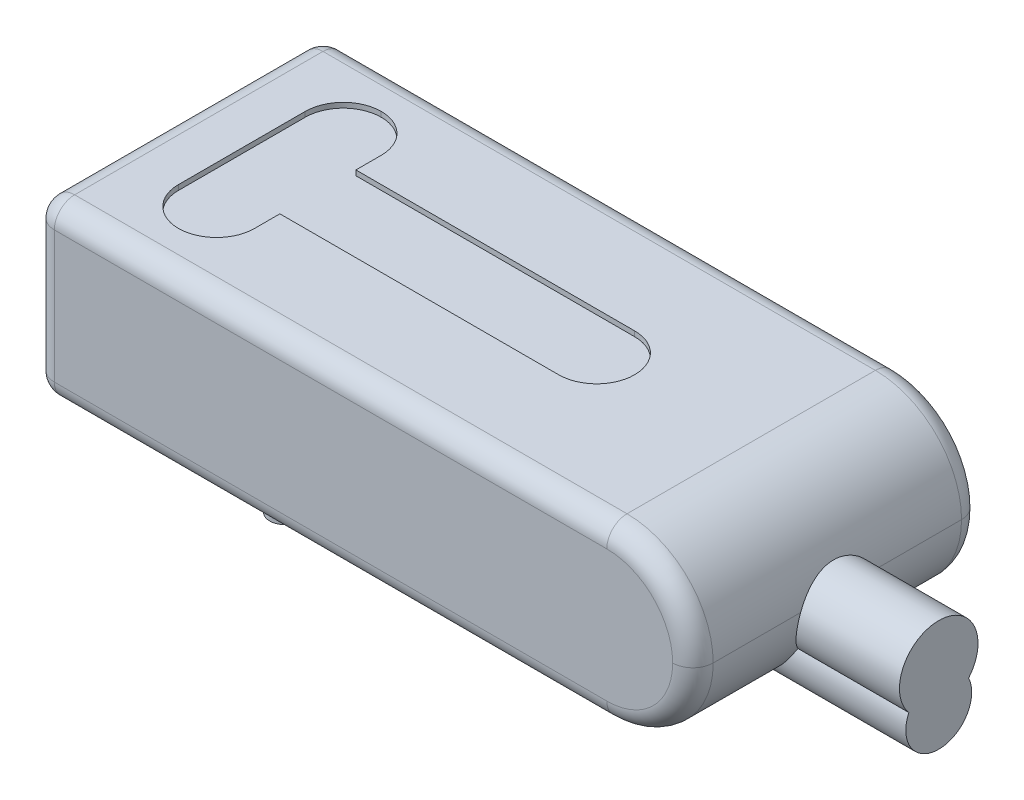
from build123d import *
from build123d.topology import SkipClean

# Parameters (mm, degrees)
CROQUIS1_W              = 130
CROQUIS1_H              = 57
SALIENTE_EXTRUIR1_DEPTH = 34
REDONDEO1_R             = 17
CROQUIS2_R              = 6.5
CROQUIS2_R_2            = 7.75
SALIENTE_EXTRUIR2_DEPTH = 37
REDONDEO2_R             = 4
CROQUIS3_W              = 62.5
CROQUIS3_H              = 15
CROQUIS3_W_2            = 7.5
CORTAR_EXTRUIR1_DEPTH   = 1
REDONDEO3_R             = 7.5
CROQUIS4_R              = 1.6
CORTAR_EXTRUIR3_DEPTH   = 10
SALIENTE_EXTRUIR3_START = 2
CROQUIS5_R              = 3
CROQUIS5_R_2            = 1.6
SALIENTE_EXTRUIR3_DEPTH = 2
ROSCA1_PITCH            = 0.5
CROQUIS6_W              = 50
CROQUIS6_H              = 0.5
CORTAR_EXTRUIR4_DEPTH   = 10


with BuildPart() as part:
    # Croquis1 → Saliente-Extruir1 (new body)
    with BuildSketch(Plane(origin=(0, 0, 0), x_dir=(1, 0, 0), z_dir=(0, 1, 0))):
        Rectangle(CROQUIS1_W, CROQUIS1_H)
    extrude(amount=SALIENTE_EXTRUIR1_DEPTH)

    # Redondeo1
    redondeo1_edges = [part.edges().sort_by_distance(p)[0] for p in [
        (65, 0, 0),
        (65, 34, 0),
    ]]
    fillet(redondeo1_edges, radius=REDONDEO1_R - 0.0001)  # a hair under: the kernel refuses the full size

    # Croquis2 → Saliente-Extruir2 (add)
    with BuildSketch(Plane(origin=(48, 0, 0), x_dir=(0, 0, -1), z_dir=(1, 0, 0))):
        with Locations((0, 6.5)):
            Circle(CROQUIS2_R)
        with Locations((0, 14.25)):
            Circle(CROQUIS2_R_2)
    extrude(amount=SALIENTE_EXTRUIR2_DEPTH)

    # Redondeo2
    redondeo2_edges = [part.edges().sort_by_distance(p)[0] for p in [
        (-65, 34, 0),
        (-8.49995, 34, 28.5),
        (-8.49995, 0, -28.5),
        (-8.49995, 34, -28.5),
        (60.020844569, 29.020844569, -28.5),
        (60.020844569, 4.979155431, -28.5),
        (60.020844569, 29.020844569, 28.5),
        (60.020844569, 4.979155431, 28.5),
        (-8.49995, 0, 28.5),
        (-65, 0, 0),
        (-65, 17, 28.5),
        (-65, 17, -28.5),
    ]]
    fillet(redondeo2_edges, radius=REDONDEO2_R)

    # Croquis3 → Cortar-Extruir1 (cut)
    with BuildSketch(Plane(origin=(0, 34, 0), x_dir=(1, 0, 0), z_dir=(0, 1, 0))):
        with Locations((-6.25, 0)):
            Rectangle(CROQUIS3_W, CROQUIS3_H)
        with Locations((-41.25, 0)):
            Rectangle(CROQUIS3_W_2, CROQUIS3_H)
        Polygon((-45, 7.5), (-37.5, 7.5), (-37.5, 20), (-52.5, 20), (-52.5, -20), (-37.5, -20), (-37.5, -7.5), (-45, -7.5), align=None)
    extrude(amount=-CORTAR_EXTRUIR1_DEPTH, mode=Mode.SUBTRACT)

    # Redondeo3
    redondeo3_edges = [part.edges().sort_by_distance(p)[0] for p in [
        (-52.5, 33.5, -20),
        (-37.5, 33.5, -20),
        (25, 33.5, -7.5),
        (25, 33.5, 7.5),
        (-52.5, 33.5, 20),
        (-37.5, 33.5, 20),
    ]]
    fillet(redondeo3_edges, radius=REDONDEO3_R - 0.0001)  # a hair under: the kernel refuses the full size

    # Croquis4 → Cortar-Extruir3 (cut)
    with BuildSketch(Plane.XZ):
        with Locations(Location((-20, -24, 0), (0, 0, 270))):
            Circle(CROQUIS4_R)
    cortar_extruir3 = extrude(amount=-CORTAR_EXTRUIR3_DEPTH, mode=Mode.SUBTRACT)

    # Croquis5 → Saliente-Extruir3 (add)
    with SkipClean():  # the faces are left unmerged after this step: merging them gives an invalid solid
        with BuildSketch(Plane(origin=(0, 2, 0), x_dir=(-1, 0, 0), z_dir=(0, -1, 0)).offset(SALIENTE_EXTRUIR3_START)):
            with Locations((20, 24)):
                Circle(CROQUIS5_R)
            with Locations(Location((20, 24, 0), (0, 0, 90))):
                Circle(CROQUIS5_R_2, mode=Mode.SUBTRACT)
        saliente_extruir3 = extrude(amount=-SALIENTE_EXTRUIR3_DEPTH)

    # Rosca1: the profile of Perfil de rosca1 profile screwed along a right-hand helix of 20 turns, 6 arcs to a turn; built about Z, then put on its axis
    rosca1_z = Axis((0, 0, 0), (0, 0, 1))
    rosca1_corners = [(1.5997, 0, -0.000173205), (1.870632938, 0, 0.156249999), (1.870632938, 0, 0.218749999), (1.5997, 0, 0.375173204)]
    with BuildLine(mode=Mode.PRIVATE) as rosca1_profile:
        Line(rosca1_corners[0], rosca1_corners[1])
        Line(rosca1_corners[1], rosca1_corners[2])
        Line(rosca1_corners[2], rosca1_corners[3])
        Line(rosca1_corners[3], rosca1_corners[0])
    rosca1_cap = Face(rosca1_profile.wire())
    rosca1_turn_angles = [0, 30, 60, 90, 120, 150, 180, 210, 240, 270, 300, 330, 360]
    rosca1_turn_weights = [1, 0.8660254037844387, 1, 0.8660254037844387, 1, 0.8660254037844387, 1, 0.8660254037844387, 1, 0.8660254037844387, 1, 0.8660254037844387, 1]
    rosca1_turn_rails = [Edge.make_bspline([Vector(p[0], p[1], 0).rotate(rosca1_z, rosca1_turn_angles[k]) / rosca1_turn_weights[k] + Vector(0, 0, p[2] + ROSCA1_PITCH * rosca1_turn_angles[k] / 360) for k in range(13)], [0, 0, 0, 1, 1, 2, 2, 3, 3, 4, 4, 5, 5, 6, 6, 6], 2, rosca1_turn_weights) for p in rosca1_corners]
    rosca1_turn_sides = [Face.make_surface_from_curves(rosca1_turn_rails[p[0]], rosca1_turn_rails[p[1]]) for p in [(0, 1), (1, 2), (2, 3), (3, 0)]]
    rosca1 = Plane(origin=(-20, 0, -24), x_dir=(1, 0, 0), z_dir=(0, 1, 0)) * Solid(Shell([*[p.moved(Location((0, 0, ROSCA1_PITCH * i))) for i in range(20) for p in rosca1_turn_sides], rosca1_cap, rosca1_cap.rotate(rosca1_z, 7200).moved(Location((0, 0, ROSCA1_PITCH * 7200 / 360)))]))
    add(rosca1, mode=Mode.SUBTRACT)

    # Simetría3: Cortar-Extruir3, Saliente-Extruir3 across plane
    with SkipClean():  # the faces are left unmerged after this step: merging them gives an invalid solid
        add(cortar_extruir3.mirror(Plane.XY), mode=Mode.SUBTRACT)
        add(saliente_extruir3.mirror(Plane.XY))

    # Simetría5: Rosca1 across plane
    add(rosca1.mirror(Plane.XY), mode=Mode.SUBTRACT)

    # Croquis6 → Cortar-Extruir4 (cut)
    with BuildSketch(Plane.ZY.offset(65)):
        with Locations((0, 17)):
            Rectangle(CROQUIS6_W, CROQUIS6_H)
    extrude(amount=-CORTAR_EXTRUIR4_DEPTH, mode=Mode.SUBTRACT)


solid = part.part
